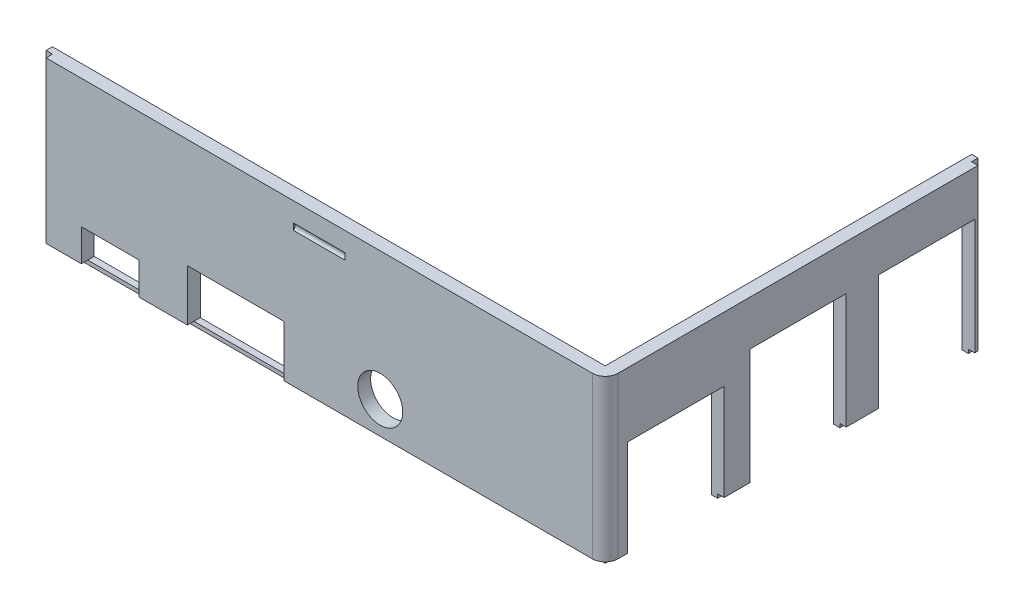
from build123d import *

# Parameters (mm, degrees)
P_IDAT_VYSUNUT_M1_DEPTH  = 25
SKICA2_W                 = 86
SKICA2_H                 = 1
P_IDAT_VYSUNUT_M2_DEPTH  = 0.6
ODEBRAT_VYSUNUT_M1_REACH = 110.858
SKICA5_R                 = 3.5
SKICA5_W                 = 9
SKICA5_H                 = 5
SKICA5_W_2               = 15
SKICA5_H_2               = 8
ODEBRAT_VYSUNUT_M2_REACH = 110.858
SKICA6_W                 = 15
SKICA6_H                 = 15.6
SKICA6_H_2               = 18.6
FILLET1_R                = 2
CUT_EXTRUDE1_START       = -40.5
CUT_EXTRUDE1_DEPTH       = 8


with BuildPart() as part:
    # Skica1 → Přidat vysunutím1 (new body)
    with BuildSketch(Plane(origin=(0, 0, 0), x_dir=(1, 0, 0), z_dir=(0, 1, 0))):
        Polygon((1, 1), (1, 0), (88, 0), (88, 58), (87, 58), (87, 59), (86, 59), (86, 2), (0, 2), (0, 1), align=None)
    extrude(amount=P_IDAT_VYSUNUT_M1_DEPTH)

    # Skica2 → Přidat vysunutím2 (add)
    with BuildSketch(Plane.XZ):
        with Locations((43, -1.5)):
            Rectangle(SKICA2_W, SKICA2_H)
        Polygon((87, -1), (86, -1), (86, -2), (86, -59), (87, -59), align=None)
    extrude(amount=P_IDAT_VYSUNUT_M2_DEPTH)

    # Skica5 → Odebrat vysunutím1 (cut, up to next)
    with BuildSketch(Plane.XY, mode=Mode.PRIVATE) as odebrat_vysunut_m1_sk1:
        with Locations((53, 5)):
            Circle(SKICA5_R)
    odebrat_vysunut_m1_tool1 = extrude(odebrat_vysunut_m1_sk1.sketch, amount=-ODEBRAT_VYSUNUT_M1_REACH, mode=Mode.PRIVATE) & part.part
    # Skica5 → Odebrat vysunutím1 (cut, up to next)
    with BuildSketch(Plane.XY, mode=Mode.PRIVATE) as odebrat_vysunut_m1_sk2:
        with Locations((11, 2.5)):
            Rectangle(SKICA5_W, SKICA5_H)
    odebrat_vysunut_m1_tool2 = extrude(odebrat_vysunut_m1_sk2.sketch, amount=-ODEBRAT_VYSUNUT_M1_REACH, mode=Mode.PRIVATE) & part.part
    # Skica5 → Odebrat vysunutím1 (cut, up to next)
    with BuildSketch(Plane.XY, mode=Mode.PRIVATE) as odebrat_vysunut_m1_sk3:
        with Locations((30.5, 4)):
            Rectangle(SKICA5_W_2, SKICA5_H_2)
    odebrat_vysunut_m1_tool3 = extrude(odebrat_vysunut_m1_sk3.sketch, amount=-ODEBRAT_VYSUNUT_M1_REACH, mode=Mode.PRIVATE) & part.part
    add(odebrat_vysunut_m1_tool1.solids().sort_by_distance((53, 5, 0))[0], mode=Mode.SUBTRACT)
    add(odebrat_vysunut_m1_tool2.solids().sort_by_distance((11, 2.5, 0))[0], mode=Mode.SUBTRACT)
    add(odebrat_vysunut_m1_tool3.solids().sort_by_distance((30.5, 4, 0))[0], mode=Mode.SUBTRACT)

    # Skica6 → Odebrat vysunutím2 (cut, up to next)
    with BuildSketch(Plane(origin=(88, 0, 0), x_dir=(0, 0, -1), z_dir=(1, 0, 0)), mode=Mode.PRIVATE) as odebrat_vysunut_m2_sk1:
        with Locations((11, 7.2)):
            Rectangle(SKICA6_W, SKICA6_H)
    odebrat_vysunut_m2_tool1 = extrude(odebrat_vysunut_m2_sk1.sketch, amount=-ODEBRAT_VYSUNUT_M2_REACH, mode=Mode.PRIVATE) & part.part
    # Skica6 → Odebrat vysunutím2 (cut, up to next)
    with BuildSketch(Plane(origin=(88, 0, 0), x_dir=(0, 0, -1), z_dir=(1, 0, 0)), mode=Mode.PRIVATE) as odebrat_vysunut_m2_sk2:
        with Locations((50, 8.7)):
            Rectangle(SKICA6_W, SKICA6_H_2)
    odebrat_vysunut_m2_tool2 = extrude(odebrat_vysunut_m2_sk2.sketch, amount=-ODEBRAT_VYSUNUT_M2_REACH, mode=Mode.PRIVATE) & part.part
    # Skica6 → Odebrat vysunutím2 (cut, up to next)
    with BuildSketch(Plane(origin=(88, 0, 0), x_dir=(0, 0, -1), z_dir=(1, 0, 0)), mode=Mode.PRIVATE) as odebrat_vysunut_m2_sk3:
        with Locations((30, 8.7)):
            Rectangle(SKICA6_W, SKICA6_H_2)
    odebrat_vysunut_m2_tool3 = extrude(odebrat_vysunut_m2_sk3.sketch, amount=-ODEBRAT_VYSUNUT_M2_REACH, mode=Mode.PRIVATE) & part.part
    add(odebrat_vysunut_m2_tool1.solids().sort_by_distance((88, 7.2, -11))[0], mode=Mode.SUBTRACT)
    add(odebrat_vysunut_m2_tool2.solids().sort_by_distance((88, 8.7, -50))[0], mode=Mode.SUBTRACT)
    add(odebrat_vysunut_m2_tool3.solids().sort_by_distance((88, 8.7, -30))[0], mode=Mode.SUBTRACT)

    # Fillet1
    fillet1_edges = [part.edges().sort_by_distance(p)[0] for p in [
        (88, 12.5, 0),
    ]]
    fillet(fillet1_edges, radius=FILLET1_R)

    # Sketch1 → Cut-Extrude1 (cut)
    with BuildSketch(Plane(origin=(88, 0, 0), x_dir=(0, 0, -1), z_dir=(1, 0, 0)).offset(CUT_EXTRUDE1_START)):
        with BuildLine():
            ThreePointArc((0, 21), (0.240312424, 21.5), (0, 22))
            Line((0, 22), (0, 21.5))
            Line((0, 21.5), (0, 21))
        make_face()
    extrude(amount=-CUT_EXTRUDE1_DEPTH, mode=Mode.SUBTRACT)


solid = part.part
